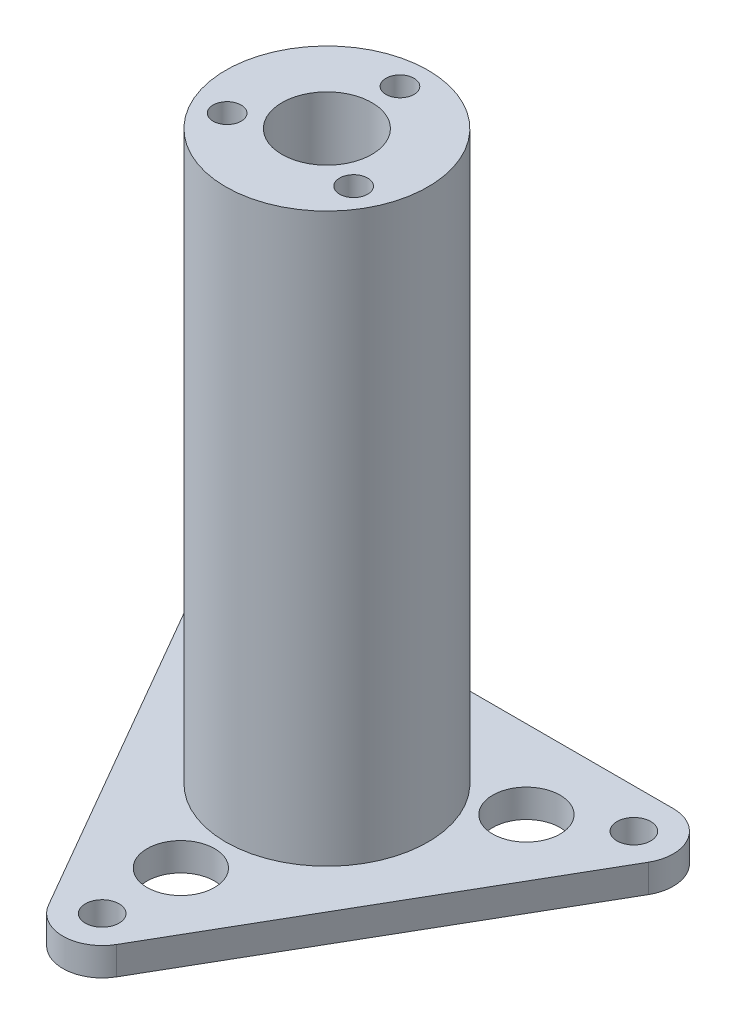
from build123d import *

# Parameters (mm, degrees)
SKETCH_9_OUTSIDE_W     = 66.002
SKETCH_9_OUTSIDE_H     = 66.002
SKETCH_9_OUTSIDE_R     = 1.5
SKETCH_9_OUTSIDE_R_2   = 3
CUT_EXTRUDE_2_DEPTH    = 63.557973113
HOLE_WIZARD_M3_1_D     = 2.5
HOLE_WIZARD_M3_1_DEPTH = 7.5
HOLE_WIZARD_M3_1_TIP   = 0.751075774
SKETCH_10_R            = 4
CUT_EXTRUDE_3_DEPTH    = 62.601489889
SKETCH_15_R            = 6
CUT_EXTRUDE_4_DEPTH    = 40
CHAMFER_1_SIZE         = 2


with BuildPart() as part:
    # 草图2 → 旋转1 (revolve)
    with BuildSketch(Plane.XY, mode=Mode.PRIVATE) as revolve_1_sk:
        Polygon((0, 0), (23.5, 0), (23.5, 2.5), (9, 2.5), (9, 53), (0, 53), align=None)
    revolve(revolve_1_sk.sketch.rotate(Axis((0, 0, 0), (0, 1, 0)), 90), axis=Axis((0, 0, 0), (0, 1, 0)))

    # 草图9 outside → 切除-拉伸2 (cut, through all)
    # profile 1 of 7: a face of its own
    with BuildSketch(Plane.XZ):
        Rectangle(SKETCH_9_OUTSIDE_W, SKETCH_9_OUTSIDE_H)
        with BuildLine():
            Line((-3.031088913, 21.75), (-20.351596989, -8.25))
            ThreePointArc((-20.351596989, -8.25), (-20.351596989, -11.75), (-17.320508076, -13.5))
            Line((-17.320508076, -13.5), (17.320508076, -13.5))
            ThreePointArc((17.320508076, -13.5), (20.351596989, -11.75), (20.351596989, -8.25))
            Line((20.351596989, -8.25), (3.031088913, 21.75))
            ThreePointArc((3.031088913, 21.75), (0, 23.5), (-3.031088913, 21.75))
        make_face(mode=Mode.SUBTRACT)
    # profile 2 of 7: a face of its own
    with BuildSketch(Plane.XZ):
        with Locations(Location((0, 20, 0), (0, 0, 270))):
            Circle(SKETCH_9_OUTSIDE_R)
    # profile 3 of 7: a face of its own
    with BuildSketch(Plane.XZ):
        with Locations(Location((17.320508076, -10, 0), (0, 0, 270))):
            Circle(SKETCH_9_OUTSIDE_R)
    # profile 4 of 7: a face of its own
    with BuildSketch(Plane.XZ):
        with Locations(Location((-17.320508076, -10, 0), (0, 0, 270))):
            Circle(SKETCH_9_OUTSIDE_R)
    # profile 5 of 7: a face of its own
    with BuildSketch(Plane.XZ):
        with Locations(Location((0, 13, 0), (0, 0, 270))):
            Circle(SKETCH_9_OUTSIDE_R_2)
    # profile 6 of 7: a face of its own
    with BuildSketch(Plane.XZ):
        with Locations(Location((11.258330249, -6.5, 0), (0, 0, 270))):
            Circle(SKETCH_9_OUTSIDE_R_2)
    # profile 7 of 7: a face of its own
    with BuildSketch(Plane.XZ):
        with Locations(Location((-11.258330249, -6.5, 0), (0, 0, 270))):
            Circle(SKETCH_9_OUTSIDE_R_2)
    extrude(amount=-CUT_EXTRUDE_2_DEPTH, mode=Mode.SUBTRACT)

    # M3 螺纹孔1
    with Locations(Plane(origin=(0, 53, 0), x_dir=(1, 0, 0), z_dir=(0, 1, 0))):
        with Locations((-5.629165125, -3.25), (0, 6.5), (5.629165125, -3.25)):
            Hole(HOLE_WIZARD_M3_1_D / 2, depth=HOLE_WIZARD_M3_1_DEPTH)
            with Locations((0, 0, -(HOLE_WIZARD_M3_1_DEPTH + HOLE_WIZARD_M3_1_TIP / 2))):  # 118° drill point
                Cone(0, HOLE_WIZARD_M3_1_D / 2, HOLE_WIZARD_M3_1_TIP, mode=Mode.SUBTRACT)

    # 草图10 → 切除-拉伸3 (cut, through all)
    with BuildSketch(Plane(origin=(0, 53, 0), x_dir=(1, 0, 0), z_dir=(0, 1, 0))):
        with Locations(Location((0, 0, 0), (0, 0, 270))):
            Circle(SKETCH_10_R)
    extrude(amount=-CUT_EXTRUDE_3_DEPTH, mode=Mode.SUBTRACT)

    # 草图15 → 切除-拉伸4 (cut)
    with BuildSketch(Plane.XZ):
        with Locations(Location((0, 0, 0), (0, 0, 270))):
            Circle(SKETCH_15_R)
    extrude(amount=-CUT_EXTRUDE_4_DEPTH, mode=Mode.SUBTRACT)

    # 倒角1
    chamfer_1_edges = [part.edges().sort_by_distance(p)[0] for p in [
        (0, 40, 6),
    ]]
    chamfer(chamfer_1_edges, length=CHAMFER_1_SIZE - 0.0001)  # a hair under: the kernel refuses the full size


solid = part.part
